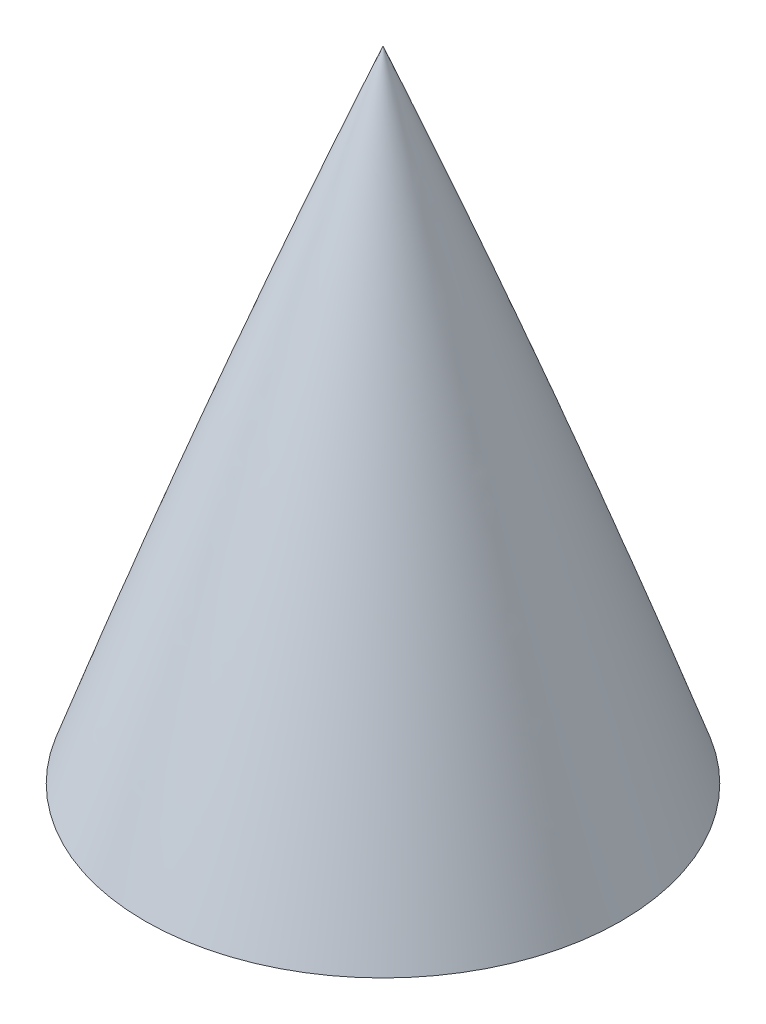
from build123d import *

# Parameters (mm, degrees)
SKETCH7_R          = 421.495799584
CUT_EXTRUDE2_DEPTH = 330.2
SKETCH8_R          = 2.413
CUT_EXTRUDE3_DEPTH = 12.7


with BuildPart() as part:
    # Sketch2 → Revolve1 (revolve)
    with BuildSketch(Plane.XY):
        with BuildLine():
            Line((-78.359, 0), (-70.485, 0))
            Line((-70.485, 0), (0, 0))
            Line((0, 0), (0, 375.92))
            Line((0, 375.92), (0, 381))
            ThreePointArc((0, 381), (-56.258776919, 194.012637953), (-78.359, 0))
        make_face()
    revolve(axis=Axis((0, 381, 0), (0, -1, 0)))

    # Sketch7 → Cut-Extrude2 (cut)
    with BuildSketch(Plane.XZ):
        with Locations((-188.314971498, 83.017725001)):
            Circle(SKETCH7_R)
    extrude(amount=-CUT_EXTRUDE2_DEPTH, mode=Mode.SUBTRACT)

    # Sketch8 → Cut-Extrude3 (cut)
    with BuildSketch(Plane(origin=(0, 330.2, 0), x_dir=(-1, 0, 0), z_dir=(0, -1, 0))):
        Circle(SKETCH8_R)
    extrude(amount=-CUT_EXTRUDE3_DEPTH, mode=Mode.SUBTRACT)


solid = part.part
